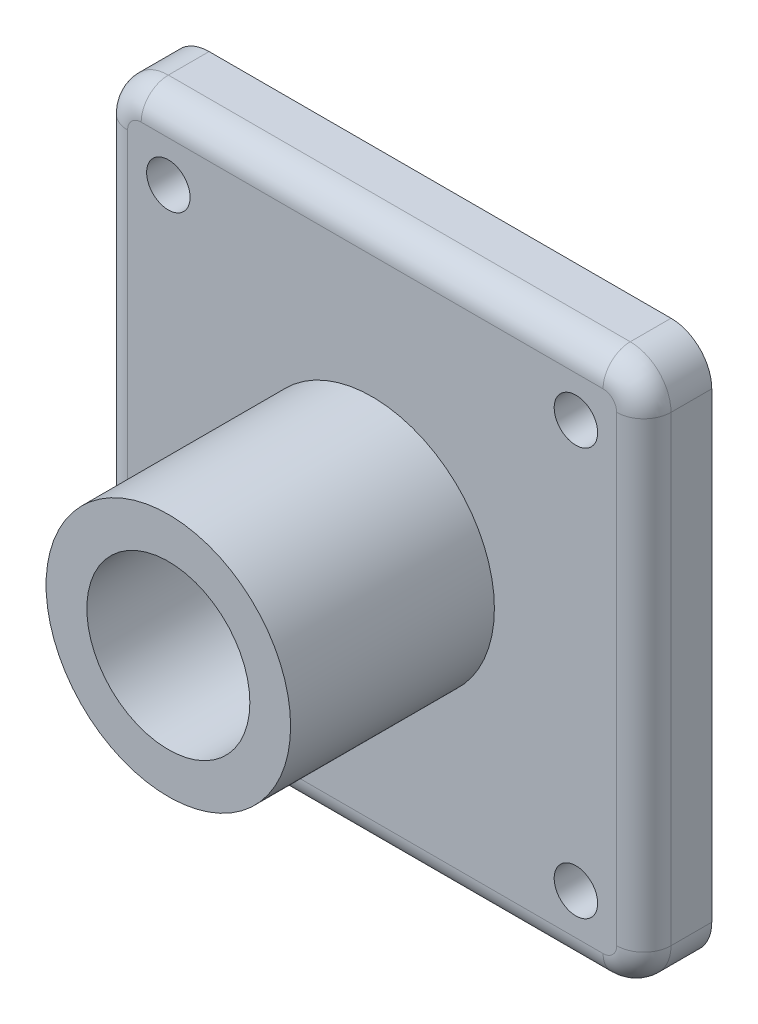
from build123d import *

# Parameters (mm, degrees)
SKETCH2_R           = 9
SKETCH2_R_2         = 6
BOSS_EXTRUDE1_DEPTH = 20
SKETCH3_R           = 6
BOSS_EXTRUDE2_DEPTH = 5
FILLET1_R           = 2
CUT_EXTRUDE1_REACH  = 188.327
SKETCH4_R           = 1.6


with BuildPart() as part:
    # Sketch2 → Boss-Extrude1 (new body)
    with BuildSketch(Plane.XY):
        with Locations((-135, -82.312657819)):
            Circle(SKETCH2_R)
        with Locations((-135, -82.312657819)):
            Circle(SKETCH2_R_2, mode=Mode.SUBTRACT)
    extrude(amount=BOSS_EXTRUDE1_DEPTH)

    # Sketch3 → Boss-Extrude2 (add)
    with BuildSketch(Plane(origin=(0, 0, 0), x_dir=(-1, 0, 0), z_dir=(0, 0, -1))):
        with BuildLine():
            Line((152, -102.312657819), (118, -102.312657819))
            ThreePointArc((118, -102.312657819), (115.878679656, -101.433978162), (115, -99.312657819))
            Line((115, -99.312657819), (115, -65.312657819))
            ThreePointArc((115, -65.312657819), (115.878679656, -63.191337475), (118, -62.312657819))
            Line((118, -62.312657819), (152, -62.312657819))
            ThreePointArc((152, -62.312657819), (154.121320344, -63.191337475), (155, -65.312657819))
            Line((155, -65.312657819), (155, -99.312657819))
            ThreePointArc((155, -99.312657819), (154.121320344, -101.433978162), (152, -102.312657819))
        make_face()
        with Locations((135, -82.312657819)):
            Circle(SKETCH3_R, mode=Mode.SUBTRACT)
    extrude(amount=-BOSS_EXTRUDE2_DEPTH)

    # Fillet1
    fillet1_edges = [part.edges().sort_by_distance(p)[0] for p in [
        (-154.121320344, -101.433978162, 5),
        (-135, -102.312657819, 5),
        (-115.878679656, -101.433978162, 5),
        (-115, -82.312657819, 5),
        (-115.878679656, -63.191337475, 5),
        (-135, -62.312657819, 5),
        (-154.121320344, -63.191337475, 5),
        (-155, -82.312657819, 5),
    ]]
    fillet(fillet1_edges, radius=FILLET1_R)

    # Sketch4 → Cut-Extrude1 (cut, up to next)
    with BuildSketch(Plane.XY.offset(5), mode=Mode.PRIVATE) as cut_extrude1_sk1:
        with Locations((-150, -67.312657819)):
            Circle(SKETCH4_R)
    cut_extrude1_tool1 = extrude(cut_extrude1_sk1.sketch, amount=-CUT_EXTRUDE1_REACH, mode=Mode.PRIVATE) & part.part
    # Sketch4 → Cut-Extrude1 (cut, up to next)
    with BuildSketch(Plane.XY.offset(5), mode=Mode.PRIVATE) as cut_extrude1_sk2:
        with Locations((-120, -67.312657819)):
            Circle(SKETCH4_R)
    cut_extrude1_tool2 = extrude(cut_extrude1_sk2.sketch, amount=-CUT_EXTRUDE1_REACH, mode=Mode.PRIVATE) & part.part
    # Sketch4 → Cut-Extrude1 (cut, up to next)
    with BuildSketch(Plane.XY.offset(5), mode=Mode.PRIVATE) as cut_extrude1_sk3:
        with Locations((-120, -97.312657819)):
            Circle(SKETCH4_R)
    cut_extrude1_tool3 = extrude(cut_extrude1_sk3.sketch, amount=-CUT_EXTRUDE1_REACH, mode=Mode.PRIVATE) & part.part
    # Sketch4 → Cut-Extrude1 (cut, up to next)
    with BuildSketch(Plane.XY.offset(5), mode=Mode.PRIVATE) as cut_extrude1_sk4:
        with Locations((-150, -97.312657819)):
            Circle(SKETCH4_R)
    cut_extrude1_tool4 = extrude(cut_extrude1_sk4.sketch, amount=-CUT_EXTRUDE1_REACH, mode=Mode.PRIVATE) & part.part
    add(cut_extrude1_tool1.solids().sort_by_distance((-150, -67.312658, 5))[0], mode=Mode.SUBTRACT)
    add(cut_extrude1_tool2.solids().sort_by_distance((-120, -67.312658, 5))[0], mode=Mode.SUBTRACT)
    add(cut_extrude1_tool3.solids().sort_by_distance((-120, -97.312658, 5))[0], mode=Mode.SUBTRACT)
    add(cut_extrude1_tool4.solids().sort_by_distance((-150, -97.312658, 5))[0], mode=Mode.SUBTRACT)


solid = part.part
